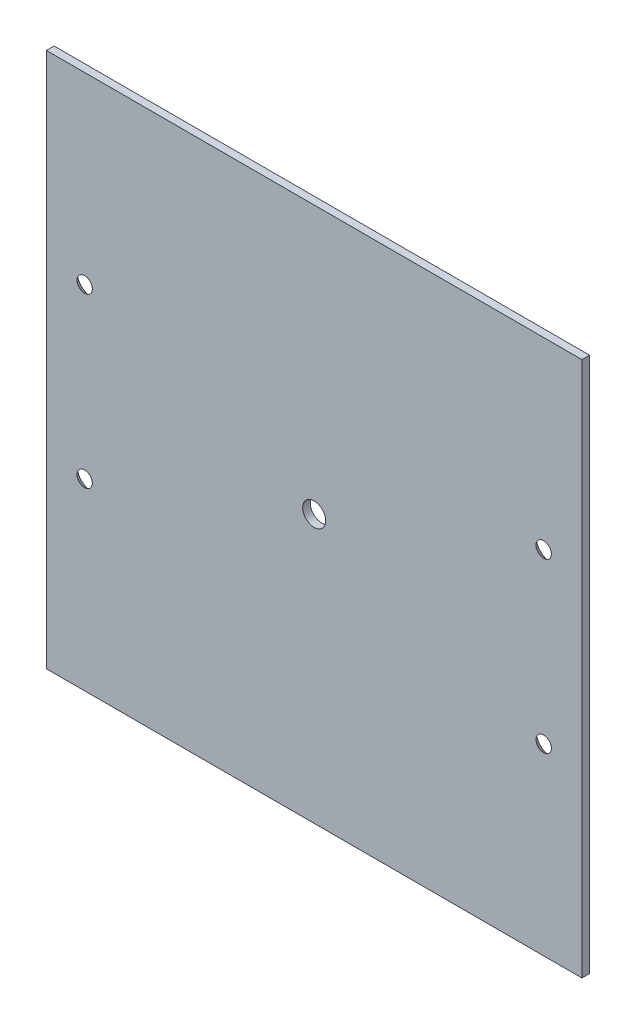
from build123d import *

# Parameters (mm, degrees)
SKETCH1_W                                      = 140
SKETCH1_H                                      = 140
BOSS_EXTRUDE1_DEPTH                            = 2
CSK_FOR_M3_FLAT_HEAD_MACHINE_SCREW1_AT_2_COUNT = 2
CSK_FOR_M3_FLAT_HEAD_MACHINE_SCREW1_AT_2_PITCH = 44
CSK_FOR_M3_FLAT_HEAD_MACHINE_SCREW1_AT_3_COUNT = 2
CSK_FOR_M3_FLAT_HEAD_MACHINE_SCREW1_AT_3_PITCH = 120
CSK_FOR_M3_FLAT_HEAD_MACHINE_SCREW1_AT_4_COUNT = 2
CSK_FOR_M3_FLAT_HEAD_MACHINE_SCREW1_AT_4_PITCH = 127.812362469
SKETCH8_R                                      = 3
CUT_EXTRUDE2_DEPTH                             = 199


with BuildPart() as part:
    # Sketch1 → Boss-Extrude1 (new body)
    with BuildSketch(Plane.XY):
        with Locations((70, 70)):
            Rectangle(SKETCH1_W, SKETCH1_H)
    extrude(amount=BOSS_EXTRUDE1_DEPTH)

    # Sketch5 → CSK for M3 Flat Head Machine Screw1 (revolve, cut)
    with BuildSketch(Plane(origin=(130, 92, 0), x_dir=(0, 1, 0), z_dir=(1, 0, 0))):
        Polygon((0, 0), (0, 2), (1.5, 2), (1.5, 2.5), (4, 0), align=None)
    csk_for_m3_flat_head_machine_screw1 = revolve(axis=Axis((130, 92, -6.35), (0, 0, 1)), mode=Mode.SUBTRACT)

    # CSK for M3 Flat Head Machine Screw1 at 2: CSK for M3 Flat Head Machine Screw1 ×2
    with Locations(*[(0, -i * CSK_FOR_M3_FLAT_HEAD_MACHINE_SCREW1_AT_2_PITCH, 0) for i in range(1, CSK_FOR_M3_FLAT_HEAD_MACHINE_SCREW1_AT_2_COUNT)]):
        add(csk_for_m3_flat_head_machine_screw1, mode=Mode.SUBTRACT)

    # CSK for M3 Flat Head Machine Screw1 at 3: CSK for M3 Flat Head Machine Screw1 ×2
    with Locations(*[(-i * CSK_FOR_M3_FLAT_HEAD_MACHINE_SCREW1_AT_3_PITCH, 0, 0) for i in range(1, CSK_FOR_M3_FLAT_HEAD_MACHINE_SCREW1_AT_3_COUNT)]):
        add(csk_for_m3_flat_head_machine_screw1, mode=Mode.SUBTRACT)

    # CSK for M3 Flat Head Machine Screw1 at 4: CSK for M3 Flat Head Machine Screw1 ×2
    with Locations(*[Vector(-0.9388763158866087, -0.3442546491584232, 0) * (i * CSK_FOR_M3_FLAT_HEAD_MACHINE_SCREW1_AT_4_PITCH) for i in range(1, CSK_FOR_M3_FLAT_HEAD_MACHINE_SCREW1_AT_4_COUNT)]):
        add(csk_for_m3_flat_head_machine_screw1, mode=Mode.SUBTRACT)

    # Sketch8 → Cut-Extrude2 (cut, through all)
    with BuildSketch(Plane(origin=(0, 0, 0), x_dir=(-1, 0, 0), z_dir=(0, 0, -1))):
        with Locations((-70, 70)):
            Circle(SKETCH8_R)
    extrude(amount=-CUT_EXTRUDE2_DEPTH, mode=Mode.SUBTRACT)


solid = part.part
